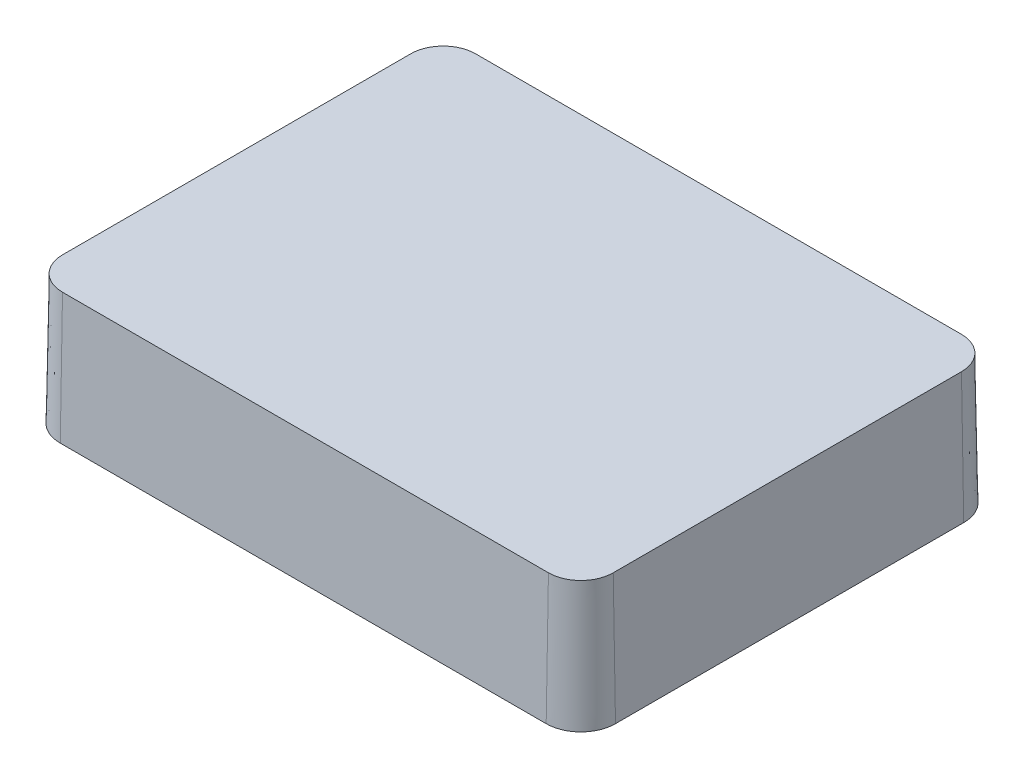
from build123d import *

# Parameters (mm, degrees)
BOSS_EXTRUDE1_DEPTH = 4
BOSS_EXTRUDE1_DRAFT = 1
SHELL1_T            = -0.5
SKETCH2_R           = 2
BOSS_EXTRUDE2_DEPTH = 5.5
BOSS_EXTRUDE2_TAPER = 1.5
RIB1_START          = -0.25
RIB1_DEPTH          = 0.5
CIRPATTERN1_COUNT   = 4


# Read off the part's stored shape, not the designer's step: Rib1
with BuildPart() as part:
    # Sketch1 → Boss-Extrude1 (with draft: the straight prism first)
    with BuildSketch(Plane(origin=(0, 0, 0), x_dir=(1, 0, 0), z_dir=(0, 1, 0))):
        with BuildLine():
            Line((-7.5, -6.375), (7.5, -6.375))
            ThreePointArc((7.5, -6.375), (8.207106781, -6.082106781), (8.5, -5.375))
            Line((8.5, -5.375), (8.5, 5.375))
            ThreePointArc((8.5, 5.375), (8.207106781, 6.082106781), (7.5, 6.375))
            Line((7.5, 6.375), (-7.5, 6.375))
            ThreePointArc((-7.5, 6.375), (-8.207106781, 6.082106781), (-8.5, 5.375))
            Line((-8.5, 5.375), (-8.5, -5.375))
            ThreePointArc((-8.5, -5.375), (-8.207106781, -6.082106781), (-7.5, -6.375))
        make_face()
    extrude(amount=-BOSS_EXTRUDE1_DEPTH)
    # Boss-Extrude1: the draft: its side faces are tilted about the plane it starts from
    boss_extrude1_sides = [part.faces().sort_by_distance(p)[0] for p in [
        (0, -2, 6.375),
        (8.207106781, -2, 6.082106781),
        (8.5, -2, 0),
        (8.207106781, -2, -6.082106781),
        (0, -2, -6.375),
        (-8.207106781, -2, -6.082106781),
        (-8.5, -2, 0),
        (-8.207106781, -2, 6.082106781),
    ]]
    draft(boss_extrude1_sides, Plane(origin=(0, 0, 0), x_dir=(1, 0, 0), z_dir=(0, 1, 0)), BOSS_EXTRUDE1_DRAFT)

    # Shell1
    shell1_openings = [part.faces().sort_by_distance(p)[0] for p in [
        (0, -4, 0),
    ]]
    offset(amount=SHELL1_T, openings=shell1_openings, kind=Kind.INTERSECTION)

    # Sketch2 → Boss-Extrude2 (add)
    with BuildSketch(Plane.XZ.offset(0.5)):
        Circle(SKETCH2_R)
    extrude(amount=BOSS_EXTRUDE2_DEPTH, taper=BOSS_EXTRUDE2_TAPER)

    # Rib1 outline → Rib1 (add)
    with BuildSketch(Plane.XY.offset(RIB1_START)):
        Polygon((-2.392140648, -4.618982479), (-1, -4.618982479), (-1, 0), (-3.073787562, 0), (-3, -0.5), align=None)
    rib1 = extrude(amount=RIB1_DEPTH)

    # CirPattern1: Rib1 ×4 about axis
    cirpattern1_axis = Axis((0, 0, 0), (0, 1, 0))
    for i in range(1, CIRPATTERN1_COUNT):
        add(rib1.rotate(cirpattern1_axis, i * 360 / CIRPATTERN1_COUNT))


solid = part.part
